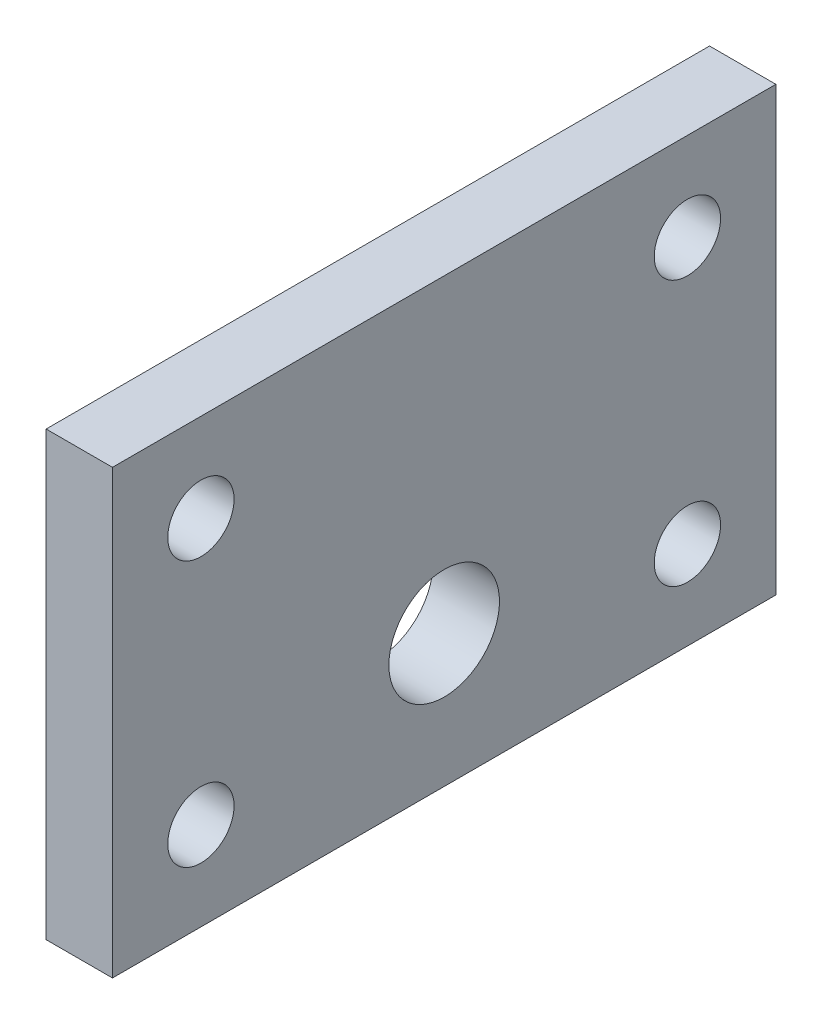
from build123d import *

# Parameters (mm, degrees)
SKETCH_1_W          = 30
SKETCH_1_H          = 20
SKETCH_1_R          = 1.5
EXTRUDE_1_DEPTH     = 3
CUT_EXTRUDE_1_REACH = 20.276
SKETCH_2_R          = 2.5


with BuildPart() as part:
    # 草图1 → 凸台-拉伸1 (new body)
    with BuildSketch(Plane(origin=(0, 0, 0), x_dir=(0, 0, -1), z_dir=(1, 0, 0))):
        Rectangle(SKETCH_1_W, SKETCH_1_H)
        with Locations((-11, 6)):
            Circle(SKETCH_1_R, mode=Mode.SUBTRACT)
        with Locations((-11, -6)):
            Circle(SKETCH_1_R, mode=Mode.SUBTRACT)
        with Locations((11, -6)):
            Circle(SKETCH_1_R, mode=Mode.SUBTRACT)
        with Locations((11, 6)):
            Circle(SKETCH_1_R, mode=Mode.SUBTRACT)
    extrude(amount=EXTRUDE_1_DEPTH)

    # 草图2 → 切除-拉伸1 (cut, up to next)
    with BuildSketch(Plane.ZY, mode=Mode.PRIVATE) as cut_extrude_1_sk1:
        with Locations((0, -4)):
            Circle(SKETCH_2_R)
    cut_extrude_1_tool1 = extrude(cut_extrude_1_sk1.sketch, amount=-CUT_EXTRUDE_1_REACH, mode=Mode.PRIVATE) & part.part
    add(cut_extrude_1_tool1.solids().sort_by_distance((0, -4, 0))[0], mode=Mode.SUBTRACT)


solid = part.part
